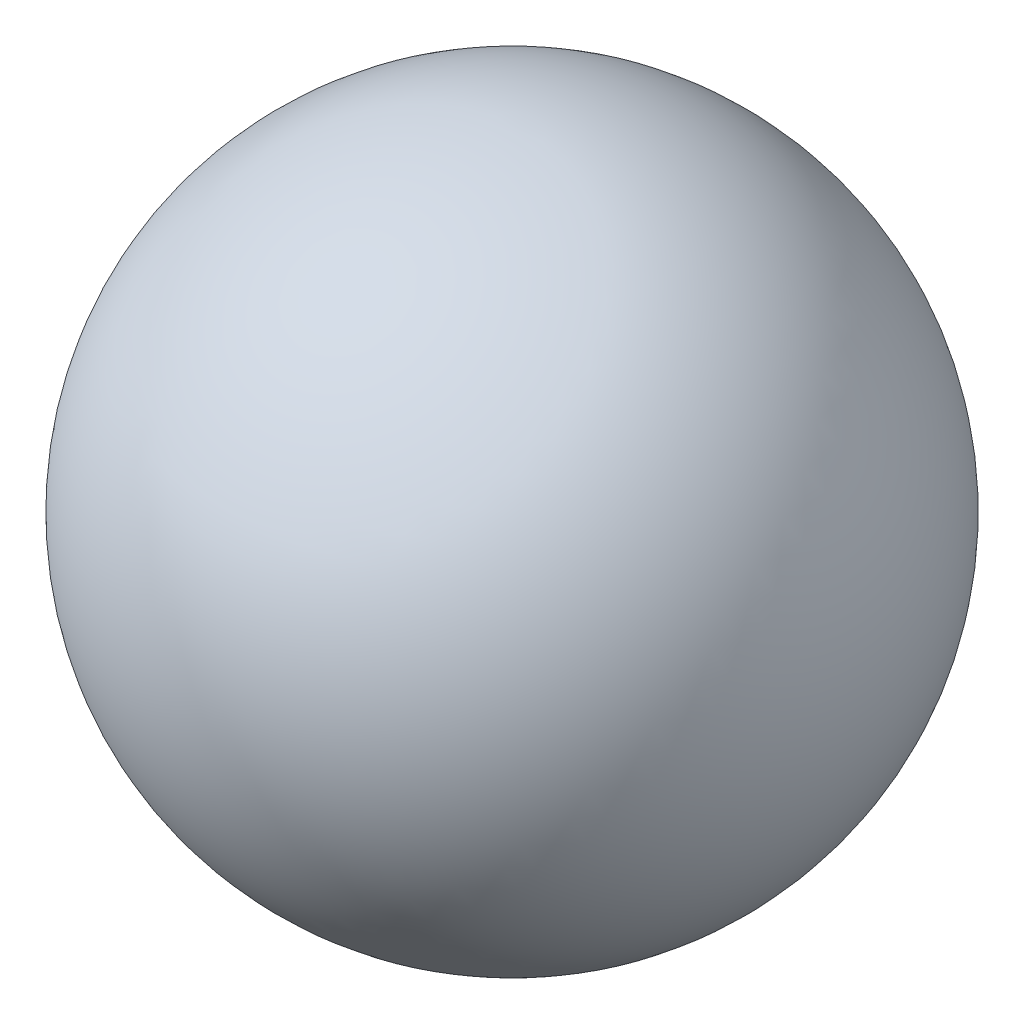
from build123d import *


with BuildPart() as part:
    # Sketch1 → Revolve1 (revolve)
    with BuildSketch(Plane.XY):
        with BuildLine():
            Line((0, 50), (0, -50))
            ThreePointArc((0, -50), (-50, 0), (0, 50))
        make_face()
    revolve(axis=Axis((0, 50, 0), (0, -1, 0)))


solid = part.part
